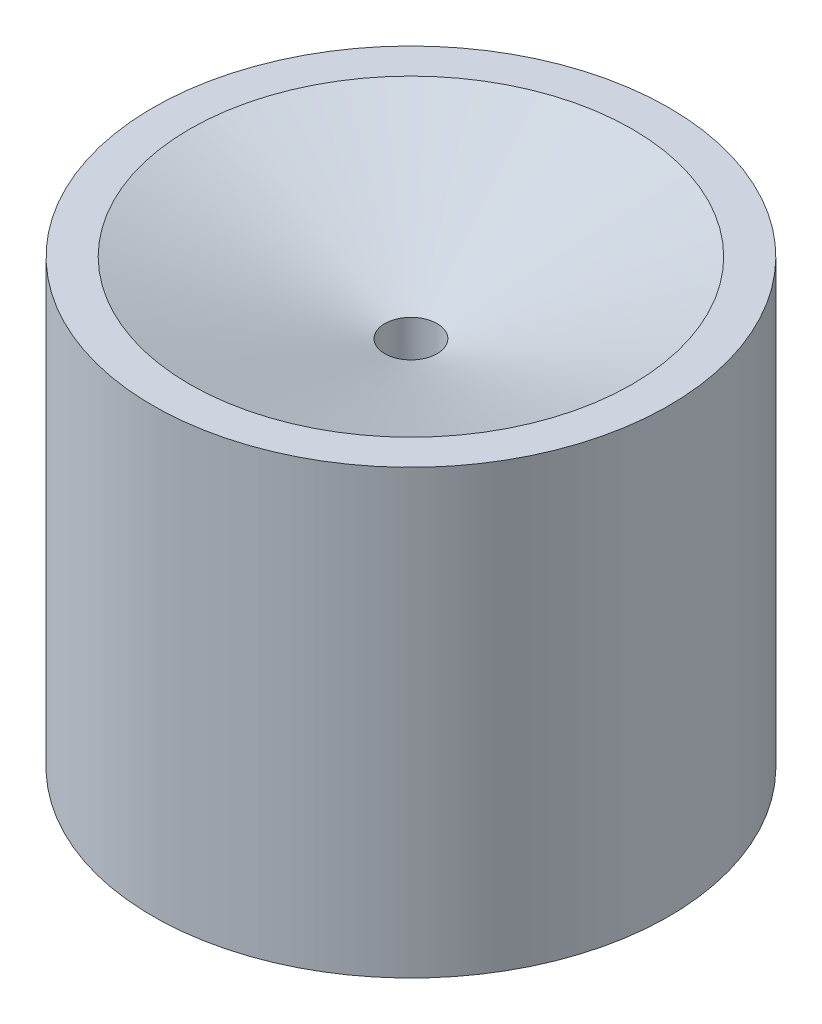
from build123d import *


with BuildPart() as part:
    # Sketch1 → Revolve1 (revolve)
    with BuildSketch(Plane.XY):
        Polygon((-44.45, 0), (-44.45, 76.2), (-38.1, 76.2), (-4.5, 63.970600129), (-4.5, 57.620600129), (-34.925, 0), align=None)
    revolve(axis=Axis((0, 0, 0), (0, 1, 0)))


solid = part.part
